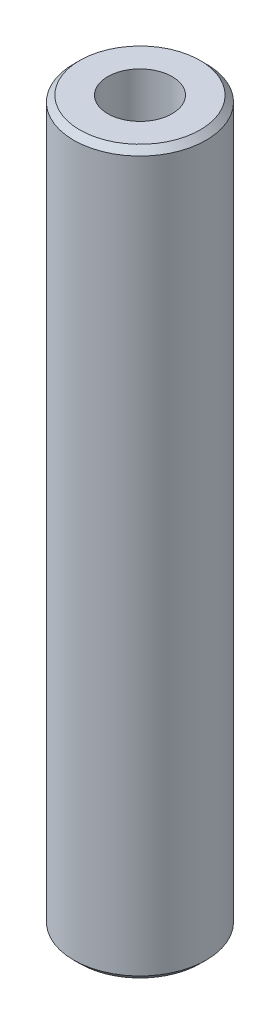
from build123d import *

# Parameters (mm, degrees)
SKETCH1_R           = 55
BOSS_EXTRUDE1_DEPTH = 600
SKETCH2_R           = 26.751151361
CUT_EXTRUDE1_DEPTH  = 606.020660804
CHAMFER1_SIZE       = 4.969519325


with BuildPart() as part:
    # Sketch1 → Boss-Extrude1 (new body)
    with BuildSketch(Plane(origin=(0, 0, 0), x_dir=(1, 0, 0), z_dir=(0, 1, 0))):
        Circle(SKETCH1_R)
    extrude(amount=BOSS_EXTRUDE1_DEPTH)

    # Sketch2 → Cut-Extrude1 (cut, through all)
    with BuildSketch(Plane(origin=(0, 0, 0), x_dir=(1, 0, 0), z_dir=(0, 1, 0))):
        Circle(SKETCH2_R)
    extrude(amount=CUT_EXTRUDE1_DEPTH, mode=Mode.SUBTRACT)

    # Chamfer1
    chamfer1_edges = [part.edges().sort_by_distance(p)[0] for p in [
        (-55, 600, 0),
        (-55, 0, 0),
    ]]
    chamfer(chamfer1_edges, length=CHAMFER1_SIZE)


solid = part.part
